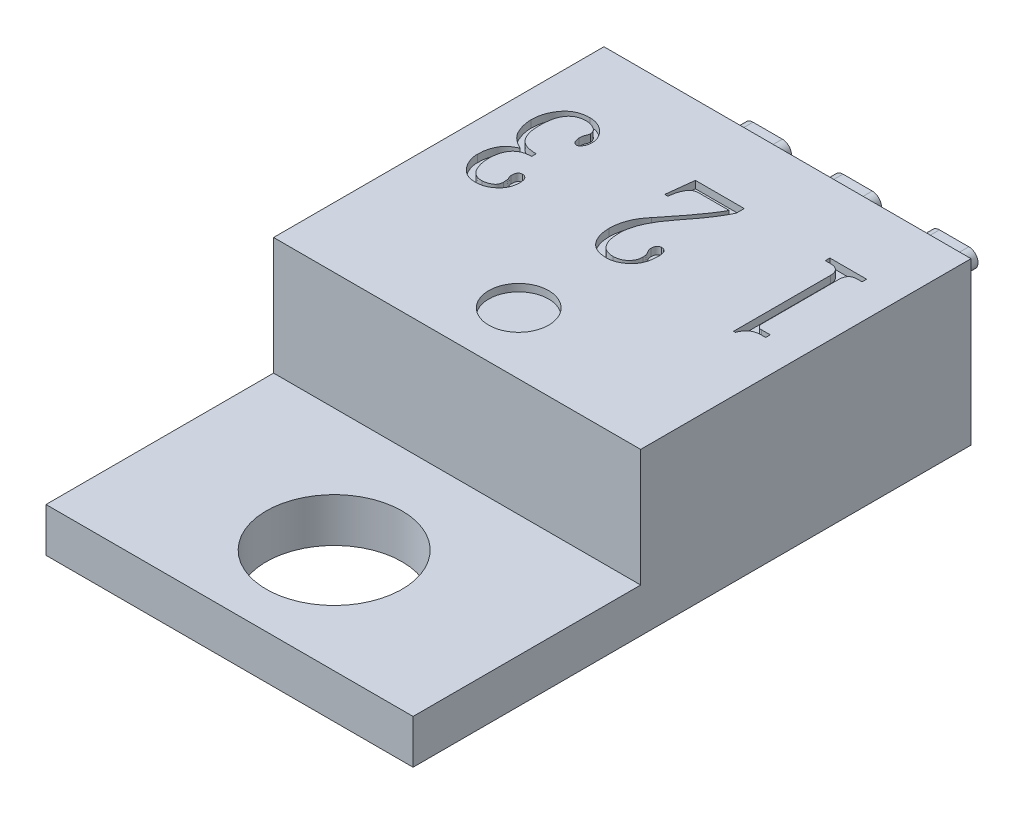
from build123d import *

# Parameters (mm, degrees)
SKETCH_1_W          = 10
SKETCH_1_H          = 4.4
EXTRUDE_1_DEPTH     = 15.2
SKETCH_2_W          = 6.2
SKETCH_2_H          = 3.2
CUT_EXTRUDE_1_DEPTH = 19.718974331
CUT_EXTRUDE_2_REACH = 20.719
SKETCH_3_R          = 1.85
SKETCH_4_R          = 0.816532351
CUT_EXTRUDE_3_DEPTH = 0.2
EXTRUDE_2_DEPTH     = 2
WRAP_START          = -0.2
WRAP_1_DEPTH        = 0.2


# Read off the part's stored shape, not the designer's step: 包覆1
with BuildPart() as part:
    # 草图1 → 凸台-拉伸1 (new body)
    with BuildSketch(Plane.XY):
        with Locations((5, 2.2)):
            Rectangle(SKETCH_1_W, SKETCH_1_H)
    extrude(amount=EXTRUDE_1_DEPTH)

    # 草图2 → 切除-拉伸1 (cut, through all)
    with BuildSketch(Plane(origin=(10, 0, 0), x_dir=(0, 0, -1), z_dir=(1, 0, 0))):
        with Locations((-12.1, 2.8)):
            Rectangle(SKETCH_2_W, SKETCH_2_H)
    extrude(amount=-CUT_EXTRUDE_1_DEPTH, mode=Mode.SUBTRACT)

    # 草图3 → 切除-拉伸2 (cut, up to next)
    with BuildSketch(Plane.XZ, mode=Mode.PRIVATE) as cut_extrude_2_sk1:
        with Locations(Location((5, 12.35, 0), (0, 0, 270))):
            Circle(SKETCH_3_R)
    cut_extrude_2_tool1 = extrude(cut_extrude_2_sk1.sketch, amount=-CUT_EXTRUDE_2_REACH, mode=Mode.PRIVATE) & part.part
    add(cut_extrude_2_tool1.solids().sort_by_distance((5, 0, 12.35))[0], mode=Mode.SUBTRACT)

    # 草图4 → 切除-拉伸3 (cut)
    with BuildSketch(Plane(origin=(0, 4.4, 0), x_dir=(-1, 0, 0), z_dir=(0, 1, 0))):
        with Locations((-5, 7.32228291)):
            Circle(SKETCH_4_R)
    extrude(amount=-CUT_EXTRUDE_3_DEPTH, mode=Mode.SUBTRACT)

    # 草图5 → 凸台-拉伸2 (add)
    with BuildSketch(Plane(origin=(0, 0, 0), x_dir=(-1, 0, 0), z_dir=(0, 0, -1))):
        with BuildLine():
            Line((-7.94, 2.65), (-7.14, 2.65))
            ThreePointArc((-7.14, 2.65), (-6.89, 2.4), (-7.14, 2.15))
            Line((-7.14, 2.15), (-7.94, 2.15))
            ThreePointArc((-7.94, 2.15), (-8.19, 2.4), (-7.94, 2.65))
        make_face()
        with BuildLine():
            Line((-2.06, 2.65), (-2.86, 2.65))
            ThreePointArc((-2.86, 2.65), (-3.11, 2.4), (-2.86, 2.15))
            Line((-2.86, 2.15), (-2.06, 2.15))
            ThreePointArc((-2.06, 2.15), (-1.81, 2.4), (-2.06, 2.65))
        make_face()
        with BuildLine():
            Line((-4.51, 2.65), (-5.31, 2.65))
            ThreePointArc((-5.31, 2.65), (-5.56, 2.4), (-5.31, 2.15))
            Line((-5.31, 2.15), (-4.51, 2.15))
            ThreePointArc((-4.51, 2.15), (-4.26, 2.4), (-4.51, 2.65))
        make_face()
    extrude(amount=EXTRUDE_2_DEPTH)

    # 包覆1 outline → 包覆1 (cut)
    with BuildSketch(Plane(origin=(0, 4.4, 0), x_dir=(1, 0, 0), z_dir=(0, 1, 0)).offset(WRAP_START)):
        with BuildLine():
            add(Edge.make_bspline(
                [(8.479166667, -2.309753021), (8.478420441, -2.287960675), (8.477007984, -2.246712094), (8.463163617, -2.189349608), (8.441204669, -2.13977527), (8.40826551, -2.100396502), (8.368423111, -2.068596021), (8.320365697, -2.047507122), (8.265703339, -2.03405772), (8.226868724, -2.032552408), (8.206380208, -2.031758229)],
                knots=[0, 0, 0, 0, 0.147024724, 0.278288596, 0.396397854, 0.510014185, 0.621798184, 0.737960856, 0.861752379, 1, 1, 1, 1], degree=3))
            Line((8.479166667, -2.309753021), (8.479166667, -4.948424896))
            Line((8.479166667, -4.948424896), (8.531901042, -4.948424896))
            add(Edge.make_bspline(
                [(8.943359375, -4.656758229), (8.917897565, -4.65753604), (8.86917448, -4.659024439), (8.799793565, -4.672963493), (8.737692015, -4.695465715), (8.683138513, -4.728201859), (8.635412496, -4.76982797), (8.595070723, -4.821444696), (8.558494569, -4.880658217), (8.540974901, -4.925302529), (8.531901042, -4.948424896)],
                knots=[0, 0, 0, 0, 0.140334335, 0.268540277, 0.388634677, 0.503006389, 0.617553441, 0.735916487, 0.863224774, 1, 1, 1, 1], degree=3))
            Line((8.943359375, -4.656758229), (9.0625, -4.656758229))
            Line((9.0625, -4.656758229), (9.0625, -4.531758229))
            Line((9.0625, -4.531758229), (8.821614583, -4.531758229))
            add(Edge.make_bspline(
                [(8.6875, -4.377461354), (8.687766813, -4.388355603), (8.688279174, -4.409275822), (8.695221444, -4.439065955), (8.705291048, -4.465887862), (8.719896164, -4.489278286), (8.738752439, -4.508874038), (8.763292369, -4.521627922), (8.791030143, -4.530714198), (8.811114542, -4.5313998), (8.821614583, -4.531758229)],
                knots=[0, 0, 0, 0, 0.140754983, 0.270291709, 0.393965667, 0.510133123, 0.625379278, 0.74110406, 0.864650255, 1, 1, 1, 1], degree=3))
            Line((8.6875, -4.377461354), (8.6875, -2.305846771))
            add(Edge.make_bspline(
                [(8.942057292, -2.031758229), (8.921173049, -2.032653284), (8.882026065, -2.03433104), (8.827433368, -2.046004203), (8.782218498, -2.068096579), (8.745606662, -2.098647629), (8.719254627, -2.139046867), (8.700184508, -2.187007191), (8.689601758, -2.24376539), (8.688228797, -2.284319697), (8.6875, -2.305846771)],
                knots=[0, 0, 0, 0, 0.145444551, 0.272632122, 0.385485353, 0.49267308, 0.600381422, 0.717669339, 0.850132977, 1, 1, 1, 1], degree=3))
            Line((8.942057292, -2.031758229), (9.0625, -2.031758229))
            Line((9.0625, -2.031758229), (9.0625, -1.906758229))
            Line((9.0625, -1.906758229), (8.0625, -1.906758229))
            Line((8.0625, -1.906758229), (8.0625, -2.031758229))
            Line((8.0625, -2.031758229), (8.206380208, -2.031758229))
        make_face()
        with BuildLine():
            add(Edge.make_bspline(
                [(5.073567708, -4.823424896), (5.101915762, -4.822081666), (5.157249239, -4.819459772), (5.236619681, -4.79797884), (5.309238955, -4.76287376), (5.373307691, -4.714103149), (5.426780898, -4.654627084), (5.466220125, -4.586237333), (5.489904223, -4.509842412), (5.49270074, -4.45640684), (5.494140625, -4.428893646)],
                knots=[0, 0, 0, 0, 0.132072592, 0.257796732, 0.380492918, 0.506225209, 0.630983799, 0.751148155, 0.871869824, 1, 1, 1, 1], degree=3))
            add(Edge.make_bspline(
                [(4.604166667, -4.173685313), (4.604571393, -4.19930194), (4.605354282, -4.24885381), (4.61053269, -4.321032066), (4.619349013, -4.388504173), (4.632565762, -4.451293723), (4.648572668, -4.509550986), (4.668706269, -4.563239038), (4.692966575, -4.612133412), (4.720037945, -4.656856659), (4.751543613, -4.696020397), (4.786255402, -4.730441178), (4.825065871, -4.759315781), (4.86777576, -4.782927367), (4.91423223, -4.801082036), (4.964256366, -4.814128322), (5.01776112, -4.822015188), (5.054660236, -4.822947282), (5.073567708, -4.823424896)],
                knots=[0, 0, 0, 0, 0.084381839, 0.163225153, 0.238242166, 0.308343114, 0.374428908, 0.437097307, 0.496881928, 0.554017834, 0.6089466, 0.662025347, 0.714639924, 0.767757168, 0.822317202, 0.878497018, 0.937740668, 1, 1, 1, 1], degree=3))
            add(Edge.make_bspline(
                [(5.063151042, -3.119648854), (5.025949021, -3.168306356), (4.954049065, -3.262346198), (4.85840783, -3.404918962), (4.779419826, -3.543969339), (4.714959447, -3.678250996), (4.66558178, -3.808286837), (4.630923211, -3.933829583), (4.608679575, -4.055059619), (4.605647818, -4.134751969), (4.604166667, -4.173685313)],
                knots=[0, 0, 0, 0, 0.157002326, 0.303436748, 0.439725638, 0.566641904, 0.6849577, 0.795772091, 0.900225361, 1, 1, 1, 1], degree=3))
            add(Edge.make_bspline(
                [(5.729166667, -2.123555104), (5.715830579, -2.152369894), (5.687111238, -2.214422707), (5.633230525, -2.310759712), (5.568811021, -2.418549939), (5.493086833, -2.537905213), (5.405264997, -2.668331668), (5.302899119, -2.808724636), (5.188651548, -2.961313795), (5.10616531, -3.065380813), (5.063151042, -3.119648854)],
                knots=[0, 0, 0, 0, 0.079295117, 0.170762488, 0.27554688, 0.393011011, 0.523828362, 0.668277617, 0.827016046, 1, 1, 1, 1], degree=3))
            Line((5.729166667, -2.123555104), (5.729166667, -1.906758229))
            Line((5.729166667, -1.906758229), (4.3984375, -1.906758229))
            Line((4.3984375, -1.906758229), (4.3125, -2.656758229))
            Line((4.3125, -2.656758229), (4.397786458, -2.656758229))
            add(Edge.make_bspline(
                [(4.724609375, -2.156758229), (4.703967695, -2.158197307), (4.663018036, -2.161052198), (4.604992469, -2.186358172), (4.553174741, -2.226937304), (4.507389152, -2.283031487), (4.468268576, -2.354475635), (4.438192714, -2.441870863), (4.41225842, -2.543677214), (4.402805422, -2.617541048), (4.397786458, -2.656758229)],
                knots=[0, 0, 0, 0, 0.094520569, 0.18751309, 0.285668795, 0.394732718, 0.517964389, 0.658061665, 0.818451643, 1, 1, 1, 1], degree=3))
            Line((4.724609375, -2.156758229), (5.5625, -2.156758229))
            add(Edge.make_bspline(
                [(4.680338542, -3.383320729), (4.713120781, -3.342749743), (4.777044826, -3.263637954), (4.869975474, -3.148181155), (4.956962339, -3.038507466), (5.037505911, -2.934406815), (5.112475623, -2.836168795), (5.181264237, -2.743767473), (5.244854744, -2.657710325), (5.302100418, -2.577144368), (5.353054837, -2.50222648), (5.399831715, -2.434601116), (5.44021623, -2.372599243), (5.4749983, -2.316808092), (5.505376903, -2.268134748), (5.529516545, -2.225485558), (5.54881941, -2.189488148), (5.55829996, -2.166806551), (5.5625, -2.156758229)],
                knots=[0, 0, 0, 0, 0.103392299, 0.201610815, 0.293784053, 0.380860719, 0.462508621, 0.538734394, 0.609199096, 0.674607105, 0.734624255, 0.788792844, 0.837591674, 0.881274272, 0.919121628, 0.951295123, 0.978422937, 1, 1, 1, 1], degree=3))
            add(Edge.make_bspline(
                [(4.354166667, -4.210143646), (4.355309527, -4.174948426), (4.357611318, -4.104063128), (4.371982351, -3.997787124), (4.397440208, -3.891970186), (4.430766973, -3.786110918), (4.476077451, -3.681724279), (4.532460367, -3.579075791), (4.600092754, -3.478277751), (4.653238537, -3.415388902), (4.680338542, -3.383320729)],
                knots=[0, 0, 0, 0, 0.116216714, 0.234067475, 0.353293336, 0.475201827, 0.600050149, 0.728314159, 0.861462432, 1, 1, 1, 1], degree=3))
            add(Edge.make_bspline(
                [(5.020833333, -4.948424896), (4.993464292, -4.947816777), (4.940277986, -4.946635018), (4.862977703, -4.937012253), (4.791374554, -4.919854213), (4.724766395, -4.897585483), (4.664608686, -4.866982935), (4.60905276, -4.831167669), (4.559368915, -4.78792181), (4.515812166, -4.737982176), (4.477780602, -4.683625578), (4.44492701, -4.625517222), (4.416804964, -4.564387163), (4.394419115, -4.49970811), (4.375479001, -4.432256152), (4.363858254, -4.361058361), (4.355516316, -4.286729772), (4.354622209, -4.235993477), (4.354166667, -4.210143646)],
                knots=[0, 0, 0, 0, 0.072741524, 0.141358734, 0.206561742, 0.268223697, 0.327558979, 0.385478104, 0.44354355, 0.501988859, 0.561203441, 0.619588936, 0.679217924, 0.739790937, 0.801363783, 0.865189598, 0.931314929, 1, 1, 1, 1], degree=3))
            add(Edge.make_bspline(
                [(5.6875, -4.206888438), (5.686908009, -4.236212679), (5.685759974, -4.293080589), (5.6759285, -4.375936604), (5.659167162, -4.453356473), (5.635620529, -4.525571485), (5.605844842, -4.592375492), (5.56871112, -4.653478266), (5.526003104, -4.710097193), (5.475612898, -4.759352186), (5.422448506, -4.803452658), (5.367731405, -4.841886359), (5.312140116, -4.874845718), (5.25542285, -4.901550391), (5.197904132, -4.922509475), (5.13976677, -4.937784146), (5.080542426, -4.946235415), (5.040823274, -4.947691882), (5.020833333, -4.948424896)],
                knots=[0, 0, 0, 0, 0.079006869, 0.153216427, 0.224453566, 0.292143017, 0.357581855, 0.421070815, 0.484470823, 0.548156115, 0.610456837, 0.670490095, 0.728163849, 0.784411487, 0.83917404, 0.892934351, 0.946115769, 1, 1, 1, 1], degree=3))
            add(Edge.make_bspline(
                [(5.522786458, -3.948424896), (5.534802204, -3.949199667), (5.558287418, -3.950713986), (5.591680418, -3.961896471), (5.62065977, -3.981691786), (5.645019822, -4.009199625), (5.665380855, -4.045051933), (5.677906268, -4.090764924), (5.686598948, -4.145573293), (5.68718361, -4.185358588), (5.6875, -4.206888438)],
                knots=[0, 0, 0, 0, 0.10412434, 0.203514834, 0.301125379, 0.405062459, 0.519679453, 0.655418804, 0.813529562, 1, 1, 1, 1], degree=3))
            add(Edge.make_bspline(
                [(5.395833333, -4.120299896), (5.396165358, -4.106824091), (5.396790213, -4.081463301), (5.402434776, -4.046117564), (5.412144154, -4.016132289), (5.4257789, -3.991029255), (5.444521596, -3.971965532), (5.466740136, -3.957376974), (5.493672546, -3.949779573), (5.512762524, -3.948891312), (5.522786458, -3.948424896)],
                knots=[0, 0, 0, 0, 0.165899722, 0.312214949, 0.438991056, 0.552697596, 0.66043657, 0.764978826, 0.876593012, 1, 1, 1, 1], degree=3))
            add(Edge.make_bspline(
                [(5.494140625, -4.428893646), (5.493508495, -4.412357064), (5.492292026, -4.380534134), (5.483209145, -4.334979496), (5.467515709, -4.293773863), (5.445204837, -4.257984395), (5.422509598, -4.224689576), (5.407827617, -4.189707762), (5.397816496, -4.155141691), (5.396491846, -4.131869181), (5.395833333, -4.120299896)],
                knots=[0, 0, 0, 0, 0.150716018, 0.290037293, 0.421595854, 0.550219654, 0.673765713, 0.788093329, 0.894656461, 1, 1, 1, 1], degree=3))
        make_face()
        with BuildLine():
            add(Edge.make_bspline(
                [(1.48046875, -1.865091563), (1.501334205, -1.865518209), (1.542591903, -1.866361826), (1.603358959, -1.875311797), (1.662024455, -1.888778783), (1.718294168, -1.9077462), (1.77238354, -1.932153702), (1.824237808, -1.96207811), (1.874156244, -1.997356235), (1.920346865, -2.038210438), (1.96280544, -2.082115605), (2.001206254, -2.127395674), (2.032253439, -2.175491039), (2.058823249, -2.224431197), (2.079177884, -2.275571407), (2.093142632, -2.328510792), (2.103053914, -2.382735446), (2.103794405, -2.419517212), (2.104166667, -2.438008229)],
                knots=[0, 0, 0, 0, 0.066748597, 0.131983391, 0.196185398, 0.259234482, 0.321730021, 0.385837997, 0.450605046, 0.517067439, 0.582898737, 0.64605107, 0.706744527, 0.765793612, 0.824102498, 0.882411384, 0.940885568, 1, 1, 1, 1], degree=3))
            add(Edge.make_bspline(
                [(0.729166667, -2.710143646), (0.729829139, -2.682559627), (0.731131684, -2.62832432), (0.740348986, -2.548143298), (0.756213862, -2.470512808), (0.777328491, -2.394965675), (0.805578264, -2.322208405), (0.840468271, -2.252323152), (0.880851501, -2.184581134), (0.926576111, -2.119600253), (0.978237357, -2.060017865), (1.035029733, -2.00723292), (1.097598246, -1.963317555), (1.164999819, -1.927398152), (1.237135307, -1.899316915), (1.313945174, -1.878946074), (1.395688823, -1.867259658), (1.451785706, -1.86582508), (1.48046875, -1.865091563)],
                knots=[0, 0, 0, 0, 0.065354469, 0.128499025, 0.190921329, 0.252935667, 0.314145356, 0.375544816, 0.437803829, 0.500866681, 0.563557378, 0.624331389, 0.684107438, 0.744148297, 0.804878787, 0.867116562, 0.932055021, 1, 1, 1, 1], degree=3))
            add(Edge.make_bspline(
                [(1.257161458, -3.537617604), (1.232464162, -3.525804293), (1.184423455, -3.502825267), (1.116909526, -3.463492589), (1.055618536, -3.421143755), (1.000059949, -3.376151103), (0.950257861, -3.328759522), (0.907152726, -3.278180494), (0.869352962, -3.225402416), (0.829736472, -3.15093676), (0.79027056, -3.056019908), (0.755379553, -2.940895381), (0.733513738, -2.825552867), (0.730608761, -2.748429421), (0.729166667, -2.710143646)],
                knots=[0, 0, 0, 0, 0.078679897, 0.15304663, 0.224345913, 0.292648017, 0.358392032, 0.421662216, 0.483454101, 0.544596945, 0.663709523, 0.778381924, 0.889983913, 1, 1, 1, 1], degree=3))
            add(Edge.make_bspline(
                [(0.8125, -4.260924896), (0.813600822, -4.218304832), (0.815726154, -4.136019257), (0.836239169, -4.017553896), (0.870083069, -3.909121198), (0.909499303, -3.826234141), (0.947742807, -3.765716511), (0.980692584, -3.72385313), (1.017088504, -3.684657383), (1.057673472, -3.648729541), (1.102045796, -3.616261853), (1.150162479, -3.586679338), (1.201936577, -3.560022608), (1.238591227, -3.545151638), (1.257161458, -3.537617604)],
                knots=[0, 0, 0, 0, 0.140316761, 0.270906331, 0.394596466, 0.513557131, 0.572066998, 0.630133984, 0.68881397, 0.748070432, 0.80841677, 0.869729517, 0.934001473, 1, 1, 1, 1], degree=3))
            add(Edge.make_bspline(
                [(1.444661458, -4.948424896), (1.421400991, -4.94787166), (1.375720318, -4.946785172), (1.308859276, -4.936079818), (1.245553131, -4.918519525), (1.18587299, -4.894332095), (1.12983327, -4.863416707), (1.0774561, -4.825270899), (1.028583332, -4.780220429), (0.984206037, -4.728918914), (0.944382599, -4.673965921), (0.908993573, -4.61756569), (0.879855242, -4.55976003), (0.854708295, -4.501979274), (0.835523165, -4.442923464), (0.823049002, -4.382829563), (0.813765093, -4.322190363), (0.812921968, -4.281359813), (0.8125, -4.260924896)],
                knots=[0, 0, 0, 0, 0.06728686, 0.132143052, 0.19539137, 0.257098663, 0.318111438, 0.38018215, 0.444199397, 0.510087752, 0.576176425, 0.640498057, 0.70258466, 0.763373902, 0.82277109, 0.881911961, 0.940899175, 1, 1, 1, 1], degree=3))
            add(Edge.make_bspline(
                [(2.0625, -4.357930104), (2.062152849, -4.379239687), (2.061472824, -4.420982466), (2.051644287, -4.481717385), (2.037815091, -4.539801334), (2.016420679, -4.594517275), (1.990576942, -4.646920589), (1.958472734, -4.696312406), (1.919468893, -4.741669828), (1.876440701, -4.784543647), (1.828802854, -4.822379353), (1.779674157, -4.856770235), (1.727717241, -4.884349489), (1.675008543, -4.908528306), (1.619743398, -4.925720534), (1.563008883, -4.938976867), (1.504347587, -4.946931029), (1.464650204, -4.947924604), (1.444661458, -4.948424896)],
                knots=[0, 0, 0, 0, 0.067074849, 0.131391154, 0.193423657, 0.254895728, 0.316062726, 0.377329038, 0.439935634, 0.504251939, 0.568440866, 0.631416144, 0.692926244, 0.753544096, 0.813883563, 0.874931934, 0.937024722, 1, 1, 1, 1], degree=3))
            add(Edge.make_bspline(
                [(1.90234375, -4.115091563), (1.911979333, -4.115708288), (1.931319046, -4.116946125), (1.959488627, -4.127571013), (1.986421233, -4.144361981), (2.0129378, -4.167207887), (2.036900475, -4.199288065), (2.051358471, -4.243506689), (2.061121571, -4.297156445), (2.062016258, -4.336602377), (2.0625, -4.357930104)],
                knots=[0, 0, 0, 0, 0.088524627, 0.17767901, 0.273675413, 0.379926783, 0.498681573, 0.637194773, 0.803837539, 1, 1, 1, 1], degree=3))
            add(Edge.make_bspline(
                [(1.770833333, -4.305195729), (1.771248773, -4.291511716), (1.772043342, -4.265339732), (1.776851348, -4.228300752), (1.786117286, -4.195631294), (1.798813469, -4.167268898), (1.816452203, -4.14348491), (1.84036188, -4.126635517), (1.869684775, -4.116555636), (1.890971335, -4.115601378), (1.90234375, -4.115091563)],
                knots=[0, 0, 0, 0, 0.156112983, 0.29858099, 0.424718021, 0.542099982, 0.651512978, 0.757974457, 0.87069706, 1, 1, 1, 1], degree=3))
            add(Edge.make_bspline(
                [(1.826822917, -4.564310313), (1.826539101, -4.543433362), (1.826029468, -4.505945619), (1.820590709, -4.456315035), (1.814401778, -4.418071838), (1.796005739, -4.386597477), (1.773750454, -4.3528058), (1.771831968, -4.321494362), (1.770833333, -4.305195729)],
                knots=[0, 0, 0, 0, 0.232299806, 0.417129644, 0.558530385, 0.656982923, 0.821448333, 1, 1, 1, 1], degree=3))
            add(Edge.make_bspline(
                [(1.501953125, -4.823424896), (1.518715706, -4.822575701), (1.55322902, -4.820827252), (1.605787323, -4.809167835), (1.659882256, -4.789955591), (1.713997769, -4.764360578), (1.764223704, -4.730737343), (1.801539717, -4.684184761), (1.82327735, -4.627033027), (1.825597366, -4.585990867), (1.826822917, -4.564310313)],
                knots=[0, 0, 0, 0, 0.10857374, 0.22354788, 0.347145276, 0.479811668, 0.610874465, 0.734918754, 0.859970614, 1, 1, 1, 1], degree=3))
            add(Edge.make_bspline(
                [(1.0625, -4.207539479), (1.063610992, -4.247346959), (1.065775473, -4.324901573), (1.08669063, -4.437358705), (1.119829615, -4.54225771), (1.158089341, -4.62353175), (1.195661828, -4.681991579), (1.228221805, -4.719709462), (1.26416122, -4.752277944), (1.304722354, -4.777925677), (1.348503268, -4.798914502), (1.396491393, -4.812670767), (1.447958776, -4.822399429), (1.483675043, -4.823077757), (1.501953125, -4.823424896)],
                knots=[0, 0, 0, 0, 0.140396554, 0.273526502, 0.402170689, 0.527917507, 0.589321198, 0.646902587, 0.703330996, 0.759852925, 0.815711678, 0.87411776, 0.935578766, 1, 1, 1, 1], degree=3))
            add(Edge.make_bspline(
                [(1.604166667, -3.573424896), (1.581788327, -3.573884614), (1.53840602, -3.574775817), (1.475434803, -3.582806011), (1.416874663, -3.595449032), (1.36295669, -3.613859696), (1.313418457, -3.637146087), (1.269154801, -3.667093809), (1.228238793, -3.700640219), (1.193049536, -3.740314114), (1.162255843, -3.784354609), (1.135760418, -3.832718725), (1.112531344, -3.88505148), (1.095015788, -3.94206169), (1.079298195, -4.002485275), (1.07049446, -4.06738332), (1.063255012, -4.135979881), (1.062756684, -4.183211102), (1.0625, -4.207539479)],
                knots=[0, 0, 0, 0, 0.07042517, 0.136525154, 0.199515341, 0.258715867, 0.315555054, 0.371266137, 0.426552468, 0.481703542, 0.53761953, 0.595419677, 0.655079692, 0.717522823, 0.782977014, 0.851388226, 0.92345141, 1, 1, 1, 1], degree=3))
            Line((1.604166667, -3.573424896), (1.604166667, -3.448424896))
            add(Edge.make_bspline(
                [(0.979166667, -2.745299896), (0.979423258, -2.771146031), (0.979922231, -2.821406952), (0.987217689, -2.89477001), (0.995978237, -2.964624482), (1.011681241, -3.030271754), (1.029341071, -3.092592195), (1.052370456, -3.150629913), (1.079101306, -3.204881761), (1.109614306, -3.255601488), (1.145890513, -3.302133801), (1.191065804, -3.341101258), (1.242451643, -3.374733846), (1.300930254, -3.402166783), (1.366899951, -3.42281243), (1.439798179, -3.437389665), (1.519732167, -3.446623154), (1.575277073, -3.447808423), (1.604166667, -3.448424896)],
                knots=[0, 0, 0, 0, 0.071376785, 0.138800753, 0.203586863, 0.265698349, 0.325084397, 0.382428354, 0.437937235, 0.492028969, 0.545780646, 0.600157442, 0.656037515, 0.715047007, 0.778003664, 0.846561909, 0.920194949, 1, 1, 1, 1], degree=3))
            add(Edge.make_bspline(
                [(1.514973958, -1.990091563), (1.493229838, -1.990422642), (1.451052179, -1.991064846), (1.390082561, -2.000866976), (1.333110303, -2.014626478), (1.280350858, -2.035338323), (1.2313654, -2.060896834), (1.187447366, -2.093588708), (1.147027, -2.130977551), (1.11122284, -2.174856867), (1.080020353, -2.224928428), (1.052333731, -2.280602565), (1.030057481, -2.342812856), (1.010809303, -2.411028907), (0.997069685, -2.485837646), (0.986718511, -2.566899157), (0.980026584, -2.654042606), (0.979459209, -2.71425432), (0.979166667, -2.745299896)],
                knots=[0, 0, 0, 0, 0.061729554, 0.119738491, 0.175089409, 0.228008746, 0.280436941, 0.331635248, 0.383129929, 0.436596407, 0.492040038, 0.550519272, 0.612965745, 0.679560401, 0.751778969, 0.828896525, 0.911777864, 1, 1, 1, 1], degree=3))
            add(Edge.make_bspline(
                [(1.868489583, -2.232279063), (1.867059856, -2.215360656), (1.864222909, -2.181790201), (1.842531235, -2.134085875), (1.806401226, -2.092406442), (1.758356443, -2.057255409), (1.7030877, -2.028053202), (1.643614833, -2.0051621), (1.58013273, -1.993001763), (1.536937984, -1.991072547), (1.514973958, -1.990091563)],
                knots=[0, 0, 0, 0, 0.107545275, 0.213397381, 0.327229397, 0.455540919, 0.590390489, 0.724707378, 0.860016909, 1, 1, 1, 1], degree=3))
            add(Edge.make_bspline(
                [(1.8125, -2.491393646), (1.813497638, -2.464442621), (1.815366608, -2.413952692), (1.8386777, -2.346458996), (1.863770404, -2.28911469), (1.866993583, -2.250296198), (1.868489583, -2.232279063)],
                knots=[0, 0, 0, 0, 0.301490384, 0.564810724, 0.798012139, 1, 1, 1, 1], degree=3))
            add(Edge.make_bspline(
                [(1.951822917, -2.698424896), (1.939908868, -2.697749755), (1.91674204, -2.696436945), (1.88543641, -2.680171189), (1.860201981, -2.654608585), (1.842790708, -2.62100942), (1.83008606, -2.585129591), (1.820295341, -2.550976562), (1.813831429, -2.520062576), (1.812924497, -2.500534113), (1.8125, -2.491393646)],
                knots=[0, 0, 0, 0, 0.128565007, 0.249994244, 0.373539806, 0.51411819, 0.657542778, 0.787595132, 0.900582052, 1, 1, 1, 1], degree=3))
            add(Edge.make_bspline(
                [(2.104166667, -2.438008229), (2.103477621, -2.454747417), (2.102124817, -2.487611469), (2.093392194, -2.535493391), (2.076354833, -2.57968779), (2.055156994, -2.619726968), (2.030094305, -2.652945928), (2.005225965, -2.678595978), (1.978788688, -2.694666011), (1.96045275, -2.697221943), (1.951822917, -2.698424896)],
                knots=[0, 0, 0, 0, 0.154746808, 0.303814464, 0.447230478, 0.590800649, 0.721156533, 0.830358292, 0.920157906, 1, 1, 1, 1], degree=3))
        make_face()
    extrude(amount=WRAP_1_DEPTH, mode=Mode.SUBTRACT)


solid = part.part
